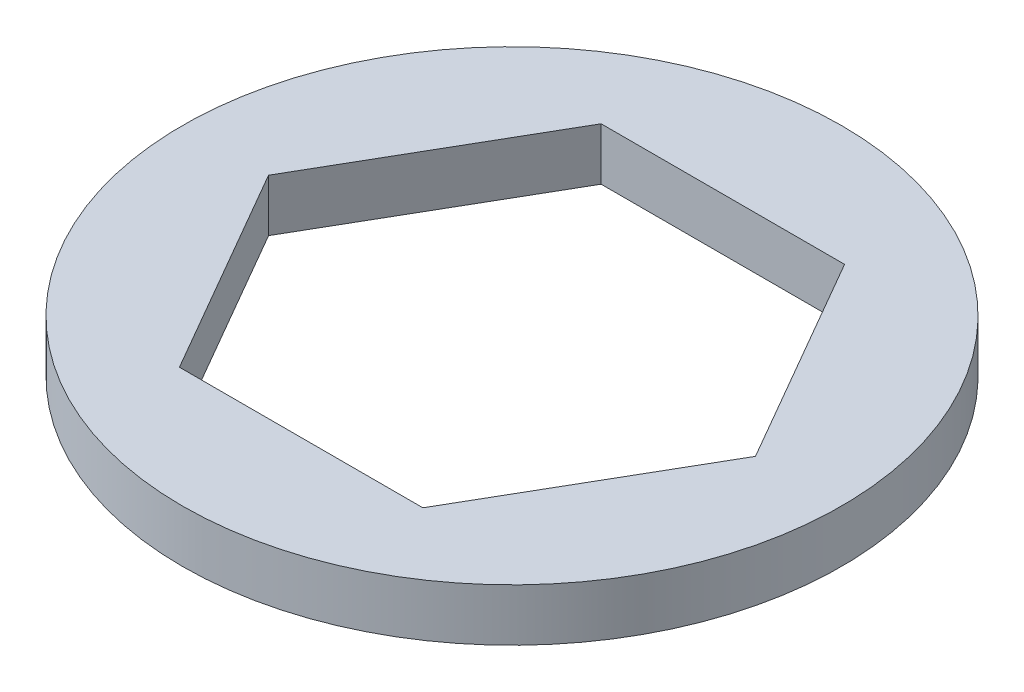
from build123d import *

# Parameters (mm, degrees)
SKETCH1_R           = 9.9949
BOSS_EXTRUDE1_DEPTH = 1.5875


with BuildPart() as part:
    # Sketch1 → Boss-Extrude1 (new body)
    with BuildSketch(Plane(origin=(0, 0, 0), x_dir=(1, 0, 0), z_dir=(0, 1, 0))):
        Circle(SKETCH1_R)
        Polygon((7.383674858, 0), (3.691837429, 6.39445), (-3.691837429, 6.39445), (-7.383674858, 0), (-3.691837429, -6.39445), (3.691837429, -6.39445), align=None, mode=Mode.SUBTRACT)
    extrude(amount=BOSS_EXTRUDE1_DEPTH)


solid = part.part
